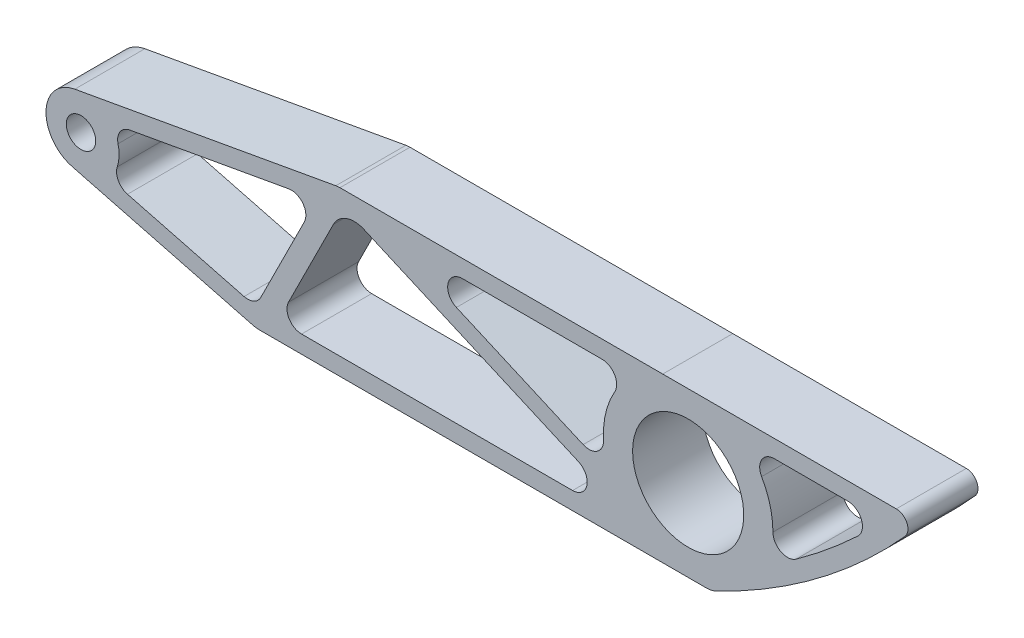
from build123d import *
from OCP.BRepFilletAPI import BRepFilletAPI_MakeFillet

# Parameters (mm, degrees)
SKETCH1_W           = 241.3
SKETCH1_H           = 44.45
BOSS_EXTRUDE1_DEPTH = 19.05
SKETCH3_R           = 4
CUT_EXTRUDE1_DEPTH  = 125.150213955
CUT_EXTRUDE2_DEPTH  = 125.150213955
SKETCH11_R          = 15.113
CUT_EXTRUDE3_DEPTH  = 125.150213955
CUT_EXTRUDE5_DEPTH  = 125.150213955
FILLET1_R1          = 6.35
FILLET1_R2          = 3.175


with BuildPart() as part:
    # Sketch1 → Boss-Extrude1 (new body)
    with BuildSketch(Plane.XY):
        Rectangle(SKETCH1_W, SKETCH1_H)
    extrude(amount=BOSS_EXTRUDE1_DEPTH)

    # Sketch3 → Cut-Extrude1 (cut, through all)
    with BuildSketch(Plane.XY.offset(19.05)):
        with Locations((-107.95, 0)):
            Circle(SKETCH3_R)
    extrude(amount=-CUT_EXTRUDE1_DEPTH, mode=Mode.SUBTRACT)

    # Sketch5 → Cut-Extrude2 (cut, through all)
    with BuildSketch(Plane.XY.offset(19.05)):
        with BuildLine():
            Line((-60.325, -22.225), (-110.34695388, -9.218472601))
            ThreePointArc((-110.34695388, -9.218472601), (-117.468006846, 0.364925571), (-109.634072253, 9.374941368))
            Line((-109.634072253, 9.374941368), (-38.1, 22.225))
            Line((-38.1, 22.225), (-120.65, 22.225))
            Line((-120.65, 22.225), (-120.65, -22.225))
            Line((-120.65, -22.225), (-60.325, -22.225))
        make_face()
        with BuildLine():
            ThreePointArc((120.65, 22.225), (94.541588466, -3.171328028), (63.5, -22.225))
            Line((63.5, -22.225), (120.65, -22.225))
            Line((120.65, -22.225), (120.65, 22.225))
        make_face()
    extrude(amount=-CUT_EXTRUDE2_DEPTH, mode=Mode.SUBTRACT)

    # Sketch11 → Cut-Extrude3 (cut, through all)
    with BuildSketch(Plane(origin=(0, 0, 0), x_dir=(-1, 0, 0), z_dir=(0, 0, -1))):
        with Locations((-57.15, 0)):
            Circle(SKETCH11_R)
    extrude(amount=-CUT_EXTRUDE3_DEPTH, mode=Mode.SUBTRACT)

    # Sketch14 → Cut-Extrude5 (cut, through all)
    with BuildSketch(Plane.XY.offset(19.05)):
        with BuildLine():
            Line((-51.522177607, -11.718871043), (-39.307054043, 12.711376085))
            ThreePointArc((-39.307054043, 12.711376085), (-35.789141805, 15.842294272), (-31.082241784, 15.689168831))
            Line((-31.082241784, 15.689168831), (27.310716862, -9.857750577))
            ThreePointArc((27.310716862, -9.857750577), (29.604638869, -14.306339642), (25.719967115, -17.4625))
            Line((25.719967115, -17.4625), (-47.972419693, -17.4625))
            ThreePointArc((-47.972419693, -17.4625), (-51.348440089, -15.580245351), (-51.522177607, -11.718871043))
        make_face()
        with BuildLine():
            Line((-5.871359091, 9.857750577), (28.586323603, -5.217485601))
            ThreePointArc((28.586323603, -5.217485601), (32.445679586, -4.837926307), (34.139019098, -1.349187974))
            ThreePointArc((34.139019098, -1.349187974), (34.717999157, 5.303855994), (37.179868392, 11.511706816))
            ThreePointArc((37.179868392, 11.511706816), (37.177849969, 15.479290565), (33.741484851, 17.4625))
            Line((33.741484851, 17.4625), (-4.280609343, 17.4625))
            ThreePointArc((-4.280609343, 17.4625), (-8.165281097, 14.306339642), (-5.871359091, 9.857750577))
        make_face()
        with BuildLine():
            Line((-47.223548504, 9.302539864), (-59.06613482, -14.382632769))
            ThreePointArc((-59.06613482, -14.382632769), (-60.974496942, -16.221172749), (-63.614623518, -16.448784063))
            Line((-63.614623518, -16.448784063), (-95.311832574, -8.206990488))
            ThreePointArc((-95.311832574, -8.206990488), (-97.789741444, -6.280105813), (-98.092861879, -3.155840312))
            ThreePointArc((-98.092861879, -3.155840312), (-97.60759886, -0.396533298), (-97.880161208, 2.391829154))
            ThreePointArc((-97.880161208, 2.391829154), (-97.338710206, 5.483713326), (-94.720536946, 7.215211435))
            Line((-94.720536946, 7.215211435), (-51.47500319, 14.98364439))
            ThreePointArc((-51.47500319, 14.98364439), (-47.59579163, 13.455312076), (-47.223548504, 9.302539864))
        make_face()
        with BuildLine():
            Line((100.573095612, 17.4625), (80.558515149, 17.4625))
            ThreePointArc((80.558515149, 17.4625), (77.122150031, 15.479290565), (77.120131608, 11.511706816))
            ThreePointArc((77.120131608, 11.511706816), (79.419190596, 5.950521023), (80.200494292, -0.016222157))
            ThreePointArc((80.200494292, -0.016222157), (82.353386148, -3.547986655), (86.47861514, -3.24667356))
            ThreePointArc((86.47861514, -3.24667356), (95.124383856, 3.395096463), (103.298808872, 10.609055252))
            ThreePointArc((103.298808872, 10.609055252), (104.260886878, 14.960437472), (100.573095612, 17.4625))
        make_face()
    extrude(amount=-CUT_EXTRUDE5_DEPTH, mode=Mode.SUBTRACT)

    # Fillet1: one fillet with a radius per group of edges: ONE call of the kernel's fillet builder (fillet() takes one radius for all edges)
    fillet1_edges_1 = [part.edges().sort_by_distance(p)[0] for p in [
        (63.5, -22.225, 9.525),
        (-60.325, -22.225, 9.525),
        (-38.1, 22.225, 9.525),
    ]]
    fillet1_edges_2 = [part.edges().sort_by_distance(p)[0] for p in [
        (120.65, 22.225, 9.525),
    ]]
    fillet1 = BRepFilletAPI_MakeFillet(part.part.solid().wrapped)
    for e in fillet1_edges_1:
        fillet1.Add(FILLET1_R1, e.wrapped)
    for e in fillet1_edges_2:
        fillet1.Add(FILLET1_R2, e.wrapped)
    add(Compound.cast(fillet1.Shape()), mode=Mode.REPLACE)


solid = part.part
